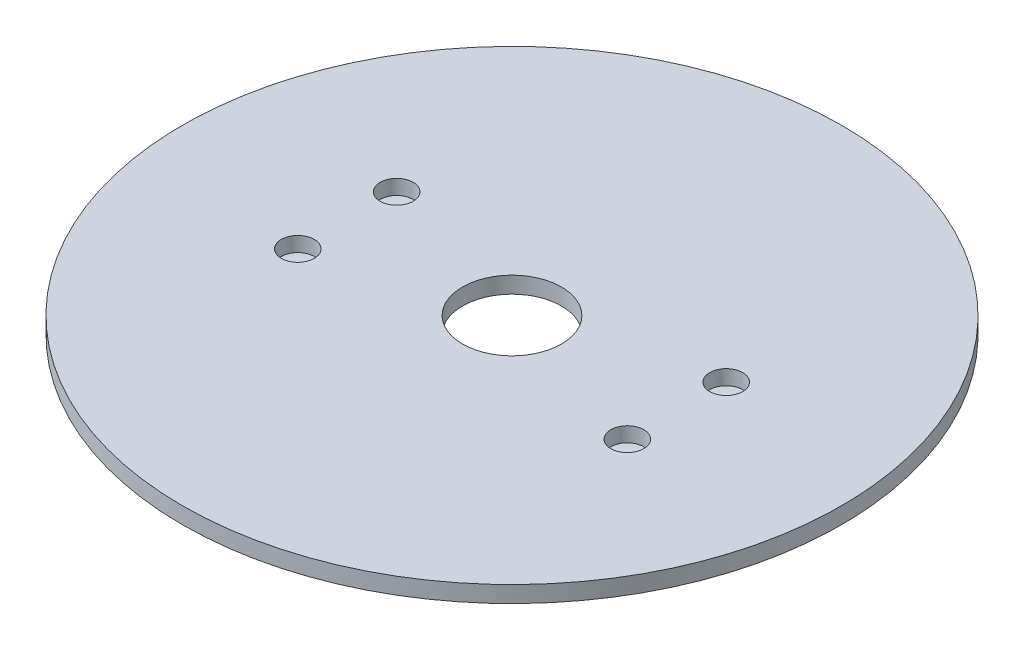
from build123d import *

# Parameters (mm, degrees)
SKETCH1_R           = 1000
BOSS_EXTRUDE1_DEPTH = 50
SKETCH2_R           = 50
CUT_EXTRUDE2_DEPTH  = 45
CUT_EXTRUDE3_DEPTH  = 45
SKETCH3_R           = 50
CUT_EXTRUDE4_DEPTH  = 45
SKETCH4_R           = 150
CUT_EXTRUDE5_DEPTH  = 50


with BuildPart() as part:
    # Sketch1 → Boss-Extrude1 (new body)
    with BuildSketch(Plane(origin=(0, 0, 0), x_dir=(1, 0, 0), z_dir=(0, 1, 0))):
        Circle(SKETCH1_R)
    extrude(amount=BOSS_EXTRUDE1_DEPTH)

    # Sketch2 → Cut-Extrude2 (cut)
    with BuildSketch(Plane(origin=(0, 50, 0), x_dir=(1, 0, 0), z_dir=(0, 1, 0))):
        with Locations((500, 150)):
            Circle(SKETCH2_R)
    extrude(amount=-CUT_EXTRUDE2_DEPTH, mode=Mode.SUBTRACT)

    # Sketch2<4> → Cut-Extrude3 (cut)
    with BuildSketch(Plane(origin=(0, 50, 0), x_dir=(1, 0, 0), z_dir=(0, 1, 0))):
        with BuildLine():
            ThreePointArc((550, -150), (535.355339059, -114.644660941), (500, -100))
            ThreePointArc((500, -100), (464.644660941, -185.355339059), (550, -150))
        make_face()
    extrude(amount=-CUT_EXTRUDE3_DEPTH, mode=Mode.SUBTRACT)

    # Sketch3 → Cut-Extrude4 (cut)
    with BuildSketch(Plane(origin=(0, 50, 0), x_dir=(1, 0, 0), z_dir=(0, 1, 0))):
        with Locations((-500, 150)):
            Circle(SKETCH3_R)
        with Locations((-500, -150)):
            Circle(SKETCH3_R)
    extrude(amount=-CUT_EXTRUDE4_DEPTH, mode=Mode.SUBTRACT)

    # Sketch4 → Cut-Extrude5 (cut)
    with BuildSketch(Plane(origin=(0, 50, 0), x_dir=(1, 0, 0), z_dir=(0, 1, 0))):
        Circle(SKETCH4_R)
    extrude(amount=-CUT_EXTRUDE5_DEPTH, mode=Mode.SUBTRACT)


solid = part.part
